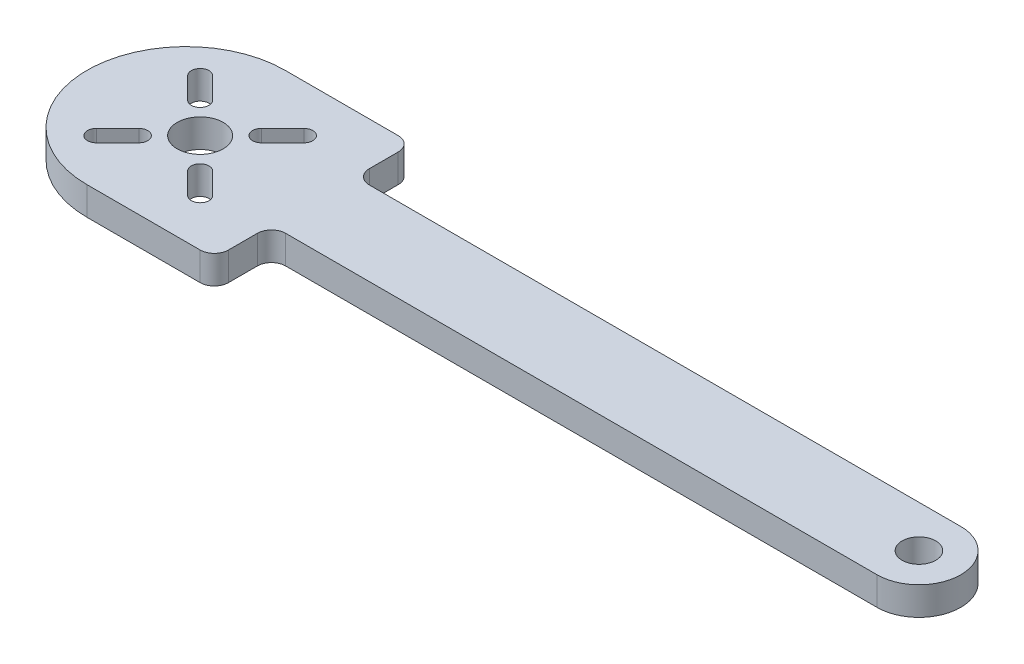
from build123d import *

# Parameters (mm, degrees)
SKETCH1_R           = 3.25
SKETCH1_R_2         = 2.38125
BOSS_EXTRUDE1_DEPTH = 4


with BuildPart() as part:
    # Sketch1 → Boss-Extrude1 (new body)
    with BuildSketch(Plane(origin=(0, 0, 0), x_dir=(1, 0, 0), z_dir=(0, 1, 0))):
        with BuildLine():
            Line((-50.8, 14), (-36.8, 14))
            ThreePointArc((-36.8, 14), (-35.385786438, 13.414213562), (-34.8, 12))
            Line((-34.8, 12), (-34.8, 7.914556152))
            ThreePointArc((-34.8, 7.914556152), (-34.214213562, 6.500342589), (-32.8, 5.914556152))
            Line((-32.8, 5.914556152), (50.8, 5.914556152))
            ThreePointArc((50.8, 5.914556152), (56.714556152, 0), (50.8, -5.914556152))
            Line((50.8, -5.914556152), (-32.8, -5.914556152))
            ThreePointArc((-32.8, -5.914556152), (-34.214213562, -6.500342589), (-34.8, -7.914556152))
            Line((-34.8, -7.914556152), (-34.8, -12))
            ThreePointArc((-34.8, -12), (-35.385786438, -13.414213562), (-36.8, -14))
            Line((-36.8, -14), (-50.8, -14))
            Line((-50.8, -14), (-52.8, -14))
            ThreePointArc((-52.8, -14), (-66.8, 0), (-52.8, 14))
            Line((-52.8, 14), (-50.8, 14))
        make_face()
        with Locations((-50.8, 0)):
            Circle(SKETCH1_R, mode=Mode.SUBTRACT)
        with Locations((50.8, 0)):
            Circle(SKETCH1_R_2, mode=Mode.SUBTRACT)
        with BuildLine():
            Line((-57.252349378, 8.220116331), (-54.247145558, 5.214912511))
            ThreePointArc((-54.247145558, 5.214912511), (-54.247145558, 3.447145558), (-56.014912511, 3.447145558))
            Line((-56.014912511, 3.447145558), (-59.020116331, 6.452349378))
            ThreePointArc((-59.020116331, 6.452349378), (-59.020116331, 8.220116331), (-57.252349378, 8.220116331))
        make_face(mode=Mode.SUBTRACT)
        with BuildLine():
            Line((-42.579883669, 6.452349378), (-45.585087489, 3.447145558))
            ThreePointArc((-45.585087489, 3.447145558), (-47.352854442, 3.447145558), (-47.352854442, 5.214912511))
            Line((-47.352854442, 5.214912511), (-44.347650622, 8.220116331))
            ThreePointArc((-44.347650622, 8.220116331), (-42.579883669, 8.220116331), (-42.579883669, 6.452349378))
        make_face(mode=Mode.SUBTRACT)
        with BuildLine():
            Line((-44.347650622, -8.220116331), (-47.352854442, -5.214912511))
            ThreePointArc((-47.352854442, -5.214912511), (-47.352854442, -3.447145558), (-45.585087489, -3.447145558))
            Line((-45.585087489, -3.447145558), (-42.579883669, -6.452349378))
            ThreePointArc((-42.579883669, -6.452349378), (-42.579883669, -8.220116331), (-44.347650622, -8.220116331))
        make_face(mode=Mode.SUBTRACT)
        with BuildLine():
            Line((-59.020116331, -6.452349378), (-56.014912511, -3.447145558))
            ThreePointArc((-56.014912511, -3.447145558), (-54.247145558, -3.447145558), (-54.247145558, -5.214912511))
            Line((-54.247145558, -5.214912511), (-57.252349378, -8.220116331))
            ThreePointArc((-57.252349378, -8.220116331), (-59.020116331, -8.220116331), (-59.020116331, -6.452349378))
        make_face(mode=Mode.SUBTRACT)
    extrude(amount=BOSS_EXTRUDE1_DEPTH)


solid = part.part
